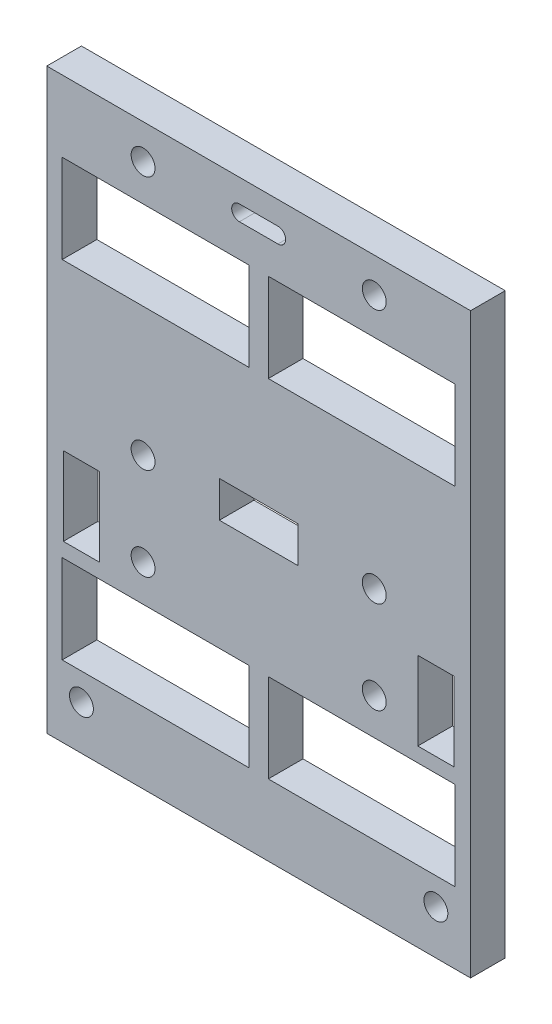
from build123d import *

# Parameters (mm, degrees)
SKETCH1_W                 = 55
SKETCH1_H                 = 75
SKETCH1_W_2               = 24.25
SKETCH1_H_2               = 11.5
BOSS_EXTRUDE1_DEPTH       = 4.5
SKETCH2_R                 = 1.55
SCREWHOLES_DEPTH          = 47.719910103
SKETCH4_W                 = 10.2
SKETCH4_H                 = 4.7
MOUNTINGPLATETAB_DEPTH    = 47.719910103
SKETCH5_R                 = 1.55
SKETCH5_W                 = 4.7
SKETCH5_H                 = 10.2
BRACETABS_DEPTH           = 47.719910103
SKETCH8_R                 = 1.55
EXPANSIONSCREWHOLES_DEPTH = 47.719910103
CABLETIESLOT_DEPTH        = 47.719910103


with BuildPart() as part:
    # Sketch1 → Boss-Extrude1 (new body)
    with BuildSketch(Plane.XY):
        Rectangle(SKETCH1_W, SKETCH1_H)
        with Locations((-13.375, 22.5)):
            Rectangle(SKETCH1_W_2, SKETCH1_H_2, mode=Mode.SUBTRACT)
        with Locations((13.375, 22.5)):
            Rectangle(SKETCH1_W_2, SKETCH1_H_2, mode=Mode.SUBTRACT)
        with Locations((13.375, -22.5)):
            Rectangle(SKETCH1_W_2, SKETCH1_H_2, mode=Mode.SUBTRACT)
        with Locations((-13.375, -22.5)):
            Rectangle(SKETCH1_W_2, SKETCH1_H_2, mode=Mode.SUBTRACT)
    extrude(amount=BOSS_EXTRUDE1_DEPTH)

    # Sketch2 → screwHoles (cut, through all)
    with BuildSketch(Plane.XY.offset(4.5)):
        with Locations((-15, 33)):
            Circle(SKETCH2_R)
        with Locations((15, 33)):
            Circle(SKETCH2_R)
        with Locations((15, 0)):
            Circle(SKETCH2_R)
        with Locations((-15, 0)):
            Circle(SKETCH2_R)
    extrude(amount=-SCREWHOLES_DEPTH, mode=Mode.SUBTRACT)

    # Sketch4 → mountingPlateTab (cut, through all)
    with BuildSketch(Plane.XY.offset(4.5)):
        Rectangle(SKETCH4_W, SKETCH4_H)
    extrude(amount=-MOUNTINGPLATETAB_DEPTH, mode=Mode.SUBTRACT)

    # Sketch5 → BraceTabs (cut, through all)
    with BuildSketch(Plane.XY.offset(4.5)):
        with Locations((23, -31.75)):
            Circle(SKETCH5_R)
        with Locations((-23, -31.75)):
            Circle(SKETCH5_R)
        with Locations((23, -9.75)):
            Rectangle(SKETCH5_W, SKETCH5_H)
        with Locations((-23, -9.75)):
            Rectangle(SKETCH5_W, SKETCH5_H)
    extrude(amount=-BRACETABS_DEPTH, mode=Mode.SUBTRACT)

    # Sketch8 → ExpansionScrewholes (cut, through all)
    with BuildSketch(Plane.XY.offset(4.5)):
        with Locations((-15, -12)):
            Circle(SKETCH8_R)
        with Locations((15, -12)):
            Circle(SKETCH8_R)
    extrude(amount=-EXPANSIONSCREWHOLES_DEPTH, mode=Mode.SUBTRACT)

    # Sketch12 → CableTieSlot (cut, through all)
    with BuildSketch(Plane.XY.offset(4.5)):
        with BuildLine():
            Line((-2.5, 34.5), (2.5, 34.5))
            ThreePointArc((2.5, 34.5), (3.5, 33.5), (2.5, 32.5))
            Line((2.5, 32.5), (-2.5, 32.5))
            ThreePointArc((-2.5, 32.5), (-3.5, 33.5), (-2.5, 34.5))
        make_face()
    extrude(amount=-CABLETIESLOT_DEPTH, mode=Mode.SUBTRACT)


solid = part.part
